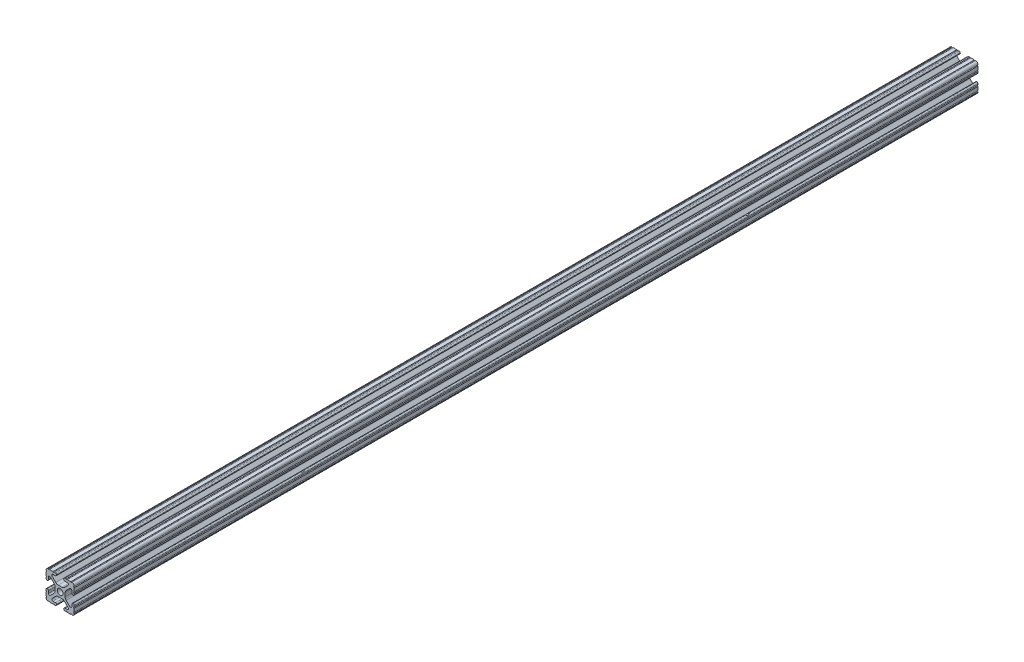
from build123d import *

# Parameters (mm, degrees)
SKETCH1_R               = 2.6035
BOSS_EXTRUDE1_DEPTH     = 406.4
CUT_EXTRUDE1_DEPTH      = 407.961847767
CUT_EXTRUDE1_DEPTH_BACK = 407.961847767
SKETCH2_R               = 3.175
CUT_EXTRUDE2_DEPTH      = 407.962384694
CUT_EXTRUDE2_DEPTH_BACK = 407.962384694
SKETCH3_R               = 3.5


with BuildPart() as part:
    # Sketch1 → Boss-Extrude1 (new, symmetric)
    with BuildSketch(Plane.XY):
        with BuildLine():
            Line((-7.179650497, -8.645192506), (-3.952270251, -5.423690499))
            ThreePointArc((-3.952270251, -5.423690499), (-2.922936451, -4.736929036), (-1.709253557, -4.4958))
            Line((-1.709253557, -4.4958), (1.709253557, -4.4958))
            ThreePointArc((1.709253557, -4.4958), (2.922936451, -4.736929036), (3.952270251, -5.423690499))
            Line((3.952270251, -5.423690499), (7.179650497, -8.645192506))
            ThreePointArc((7.179650497, -8.645192506), (7.41473083, -9.822813117), (6.416408329, -10.4902))
            Line((6.416408329, -10.4902), (4.287512407, -10.4902))
            ThreePointArc((4.287512407, -10.4902), (3.54574862, -10.79744862), (3.2385, -11.539212407))
            Line((3.2385, -11.539212407), (3.2385, -11.650987593))
            ThreePointArc((3.2385, -11.650987593), (3.54574862, -12.39275138), (4.287512407, -12.7))
            Line((4.287512407, -12.7), (5.317126718, -12.7))
            ThreePointArc((5.317126718, -12.7), (5.825126718, -12.192), (6.333126718, -12.7))
            Line((6.333126718, -12.7), (9.550443118, -12.7))
            ThreePointArc((9.550443118, -12.7), (10.058366869, -12.192000006), (10.566443095, -12.699847501))
            ThreePointArc((10.566443095, -12.699847501), (12.082537762, -12.08250727), (12.699846982, -10.566399977))
            ThreePointArc((12.699846982, -10.566399977), (12.192000006, -10.058323491), (12.7, -9.5504))
            Line((12.7, -9.5504), (12.7, -6.3330836))
            ThreePointArc((12.7, -6.3330836), (12.192, -5.8250836), (12.7, -5.3170836))
            Line((12.7, -5.3170836), (12.7, -4.287469289))
            ThreePointArc((12.7, -4.287469289), (12.39275138, -3.545705502), (11.650987593, -3.238456882))
            Line((11.650987593, -3.238456882), (11.539212407, -3.238456882))
            ThreePointArc((11.539212407, -3.238456882), (10.79744862, -3.545705502), (10.4902, -4.287469289))
            Line((10.4902, -4.287469289), (10.4902, -6.402089023))
            ThreePointArc((10.4902, -6.402089023), (9.856505071, -7.351067942), (8.737131347, -7.129408934))
            Line((8.737131347, -7.129408934), (5.441005833, -3.840816462))
            ThreePointArc((5.441005833, -3.840816462), (4.750877967, -2.809883091), (4.5085, -1.593185507))
            Line((4.5085, -1.593185507), (4.5085, 1.593185507))
            ThreePointArc((4.5085, 1.593185507), (4.750877967, 2.809883091), (5.441005833, 3.840816462))
            Line((5.441005833, 3.840816462), (8.737131347, 7.129408934))
            ThreePointArc((8.737131347, 7.129408934), (9.856505071, 7.351067942), (10.4902, 6.402089023))
            Line((10.4902, 6.402089023), (10.4902, 4.287469289))
            ThreePointArc((10.4902, 4.287469289), (10.79744862, 3.545705502), (11.539212407, 3.238456882))
            Line((11.539212407, 3.238456882), (11.650987593, 3.238456882))
            ThreePointArc((11.650987593, 3.238456882), (12.39275138, 3.545705502), (12.7, 4.287469289))
            Line((12.7, 4.287469289), (12.7, 5.3170836))
            ThreePointArc((12.7, 5.3170836), (12.192, 5.8250836), (12.7, 6.3330836))
            Line((12.7, 6.3330836), (12.7, 9.5504))
            ThreePointArc((12.7, 9.5504), (12.192000006, 10.058323491), (12.699846982, 10.566399977))
            ThreePointArc((12.699846982, 10.566399977), (12.082537762, 12.08250727), (10.566443095, 12.699847501))
            ThreePointArc((10.566443095, 12.699847501), (10.058366869, 12.192000006), (9.550443118, 12.7))
            Line((9.550443118, 12.7), (6.333126718, 12.7))
            ThreePointArc((6.333126718, 12.7), (5.825126718, 12.192), (5.317126718, 12.7))
            Line((5.317126718, 12.7), (4.287512407, 12.7))
            ThreePointArc((4.287512407, 12.7), (3.54574862, 12.39275138), (3.2385, 11.650987593))
            Line((3.2385, 11.650987593), (3.2385, 11.539212407))
            ThreePointArc((3.2385, 11.539212407), (3.54574862, 10.79744862), (4.287512407, 10.4902))
            Line((4.287512407, 10.4902), (6.476788598, 10.4902))
            ThreePointArc((6.476788598, 10.4902), (7.432222385, 9.85140422), (7.207036008, 8.724370562))
            Line((7.207036008, 8.724370562), (3.898272566, 5.423169045))
            ThreePointArc((3.898272566, 5.423169045), (2.869120213, 4.736787962), (1.655778399, 4.4958))
            Line((1.655778399, 4.4958), (-1.655778399, 4.4958))
            ThreePointArc((-1.655778399, 4.4958), (-2.869120213, 4.736787962), (-3.898272566, 5.423169045))
            Line((-3.898272566, 5.423169045), (-7.207036008, 8.724370562))
            ThreePointArc((-7.207036008, 8.724370562), (-7.432222385, 9.85140422), (-6.476788598, 10.4902))
            Line((-6.476788598, 10.4902), (-4.287512407, 10.4902))
            ThreePointArc((-4.287512407, 10.4902), (-3.54574862, 10.79744862), (-3.2385, 11.539212407))
            Line((-3.2385, 11.539212407), (-3.2385, 11.650987593))
            ThreePointArc((-3.2385, 11.650987593), (-3.54574862, 12.39275138), (-4.287512407, 12.7))
            Line((-4.287512407, 12.7), (-5.317126718, 12.7))
            ThreePointArc((-5.317126718, 12.7), (-5.825126718, 12.192), (-6.333126718, 12.7))
            Line((-6.333126718, 12.7), (-9.550443118, 12.7))
            ThreePointArc((-9.550443118, 12.7), (-10.058366869, 12.192000006), (-10.566443095, 12.699847501))
            ThreePointArc((-10.566443095, 12.699847501), (-12.082537762, 12.08250727), (-12.699846982, 10.566399977))
            ThreePointArc((-12.699846982, 10.566399977), (-12.192000006, 10.058323491), (-12.7, 9.5504))
            Line((-12.7, 9.5504), (-12.7, 6.3330836))
            ThreePointArc((-12.7, 6.3330836), (-12.192, 5.8250836), (-12.7, 5.3170836))
            Line((-12.7, 5.3170836), (-12.7, 4.287469289))
            ThreePointArc((-12.7, 4.287469289), (-12.39275138, 3.545705502), (-11.650987593, 3.238456882))
            Line((-11.650987593, 3.238456882), (-11.539212407, 3.238456882))
            ThreePointArc((-11.539212407, 3.238456882), (-10.79744862, 3.545705502), (-10.4902, 4.287469289))
            Line((-10.4902, 4.287469289), (-10.4902, 6.402089023))
            ThreePointArc((-10.4902, 6.402089023), (-9.856505071, 7.351067942), (-8.737131347, 7.129408934))
            Line((-8.737131347, 7.129408934), (-5.441005833, 3.840816462))
            ThreePointArc((-5.441005833, 3.840816462), (-4.750877967, 2.809883091), (-4.5085, 1.593185507))
            Line((-4.5085, 1.593185507), (-4.5085, -1.593185507))
            ThreePointArc((-4.5085, -1.593185507), (-4.750877967, -2.809883091), (-5.441005833, -3.840816462))
            Line((-5.441005833, -3.840816462), (-8.737131347, -7.129408934))
            ThreePointArc((-8.737131347, -7.129408934), (-9.856505071, -7.351067942), (-10.4902, -6.402089023))
            Line((-10.4902, -6.402089023), (-10.4902, -4.287469289))
            ThreePointArc((-10.4902, -4.287469289), (-10.79744862, -3.545705502), (-11.539212407, -3.238456882))
            Line((-11.539212407, -3.238456882), (-11.650987593, -3.238456882))
            ThreePointArc((-11.650987593, -3.238456882), (-12.39275138, -3.545705502), (-12.7, -4.287469289))
            Line((-12.7, -4.287469289), (-12.7, -5.3170836))
            ThreePointArc((-12.7, -5.3170836), (-12.192, -5.8250836), (-12.7, -6.3330836))
            Line((-12.7, -6.3330836), (-12.7, -9.5504))
            ThreePointArc((-12.7, -9.5504), (-12.192000006, -10.058323491), (-12.699846982, -10.566399977))
            ThreePointArc((-12.699846982, -10.566399977), (-12.082537762, -12.08250727), (-10.566443095, -12.699847501))
            ThreePointArc((-10.566443095, -12.699847501), (-10.058366869, -12.192000006), (-9.550443118, -12.7))
            Line((-9.550443118, -12.7), (-6.333126718, -12.7))
            ThreePointArc((-6.333126718, -12.7), (-5.825126718, -12.192), (-5.317126718, -12.7))
            Line((-5.317126718, -12.7), (-4.287512407, -12.7))
            ThreePointArc((-4.287512407, -12.7), (-3.54574862, -12.39275138), (-3.2385, -11.650987593))
            Line((-3.2385, -11.650987593), (-3.2385, -11.539212407))
            ThreePointArc((-3.2385, -11.539212407), (-3.54574862, -10.79744862), (-4.287512407, -10.4902))
            Line((-4.287512407, -10.4902), (-6.416408329, -10.4902))
            ThreePointArc((-6.416408329, -10.4902), (-7.41473083, -9.822813117), (-7.179650497, -8.645192506))
        make_face()
        Circle(SKETCH1_R, mode=Mode.SUBTRACT)
    extrude(amount=BOSS_EXTRUDE1_DEPTH, both=True)

    # Sketch2 → Cut-Extrude1 (cut, two sides: drawn at the far end of the back side and taken through both)
    with BuildSketch(Plane(origin=(0, 4.4958, 0), x_dir=(1, 0, 0), z_dir=(0, 1, 0)).offset(-CUT_EXTRUDE1_DEPTH_BACK)):
        with Locations((0.240663446, 250)):
            Circle(SKETCH2_R)
        with Locations((0, -250)):
            Circle(SKETCH2_R)
    extrude(amount=CUT_EXTRUDE1_DEPTH + CUT_EXTRUDE1_DEPTH_BACK, mode=Mode.SUBTRACT)

    # Sketch3 → Cut-Extrude2 (cut, two sides: drawn at the far end of the back side and taken through both)
    with BuildSketch(Plane(origin=(4.5085, 0, 0), x_dir=(0, 0, -1), z_dir=(1, 0, 0)).offset(-CUT_EXTRUDE2_DEPTH_BACK)):
        with Locations((200, 0)):
            Circle(SKETCH3_R)
        with Locations((-200, 0)):
            Circle(SKETCH3_R)
    extrude(amount=CUT_EXTRUDE2_DEPTH + CUT_EXTRUDE2_DEPTH_BACK, mode=Mode.SUBTRACT)


solid = part.part
